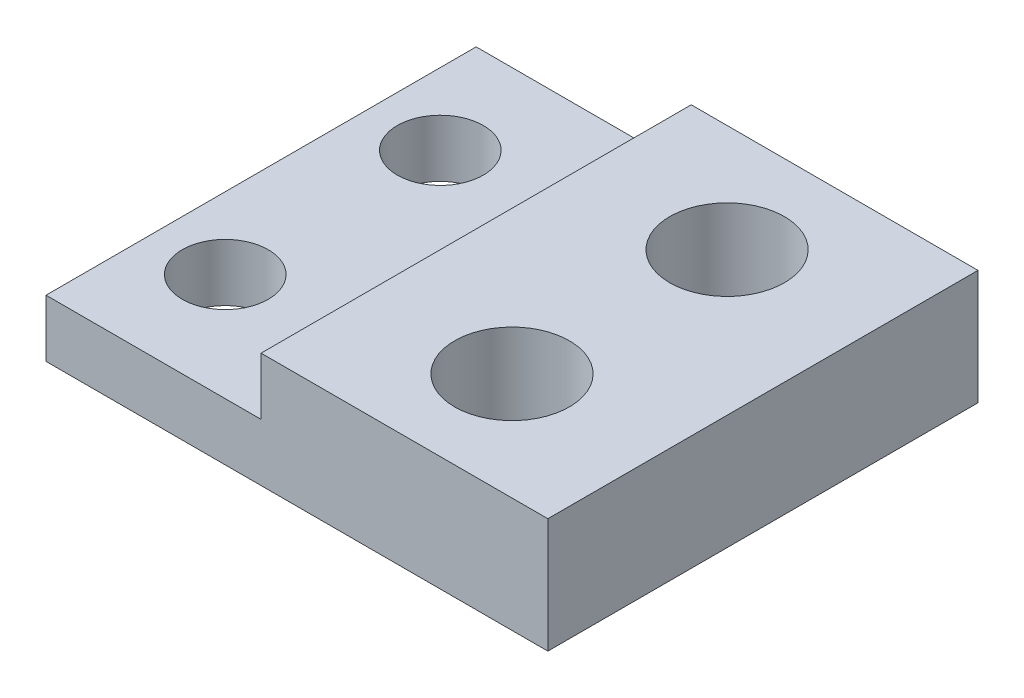
from build123d import *

# Parameters (mm, degrees)
CROQUIS1_W              = 20
CROQUIS1_H              = 15
CROQUIS1_R              = 1.5
CROQUIS1_R_2            = 2
SALIENTE_EXTRUIR1_DEPTH = 4
CROQUIS3_W              = 10
CROQUIS3_H              = 15
CORTAR_EXTRUIR1_DEPTH   = 2
CROQUIS4_W              = 2.5
CROQUIS4_H              = 15
CORTAR_EXTRUIR2_DEPTH   = 13.658988901


with BuildPart() as part:
    # Croquis1 → Saliente-Extruir1 (new body)
    with BuildSketch(Plane(origin=(0, 0, 0), x_dir=(1, 0, 0), z_dir=(0, 1, 0))):
        Rectangle(CROQUIS1_W, CROQUIS1_H)
        with Locations((-5, 3.75)):
            Circle(CROQUIS1_R, mode=Mode.SUBTRACT)
        with Locations((-5, -3.75)):
            Circle(CROQUIS1_R, mode=Mode.SUBTRACT)
        with Locations((5, 3.75)):
            Circle(CROQUIS1_R_2, mode=Mode.SUBTRACT)
        with Locations((5, -3.75)):
            Circle(CROQUIS1_R_2, mode=Mode.SUBTRACT)
    extrude(amount=SALIENTE_EXTRUIR1_DEPTH)

    # Croquis3 → Cortar-Extruir1 (cut)
    with BuildSketch(Plane(origin=(0, 4, 0), x_dir=(1, 0, 0), z_dir=(0, 1, 0))):
        with Locations((-5, 0)):
            Rectangle(CROQUIS3_W, CROQUIS3_H)
    extrude(amount=-CORTAR_EXTRUIR1_DEPTH, mode=Mode.SUBTRACT)

    # Croquis4 → Cortar-Extruir2 (cut, through all)
    with BuildSketch(Plane(origin=(0, 2, 0), x_dir=(1, 0, 0), z_dir=(0, 1, 0))):
        with Locations((-8.75, 0)):
            Rectangle(CROQUIS4_W, CROQUIS4_H)
    extrude(amount=-CORTAR_EXTRUIR2_DEPTH, mode=Mode.SUBTRACT)


solid = part.part
